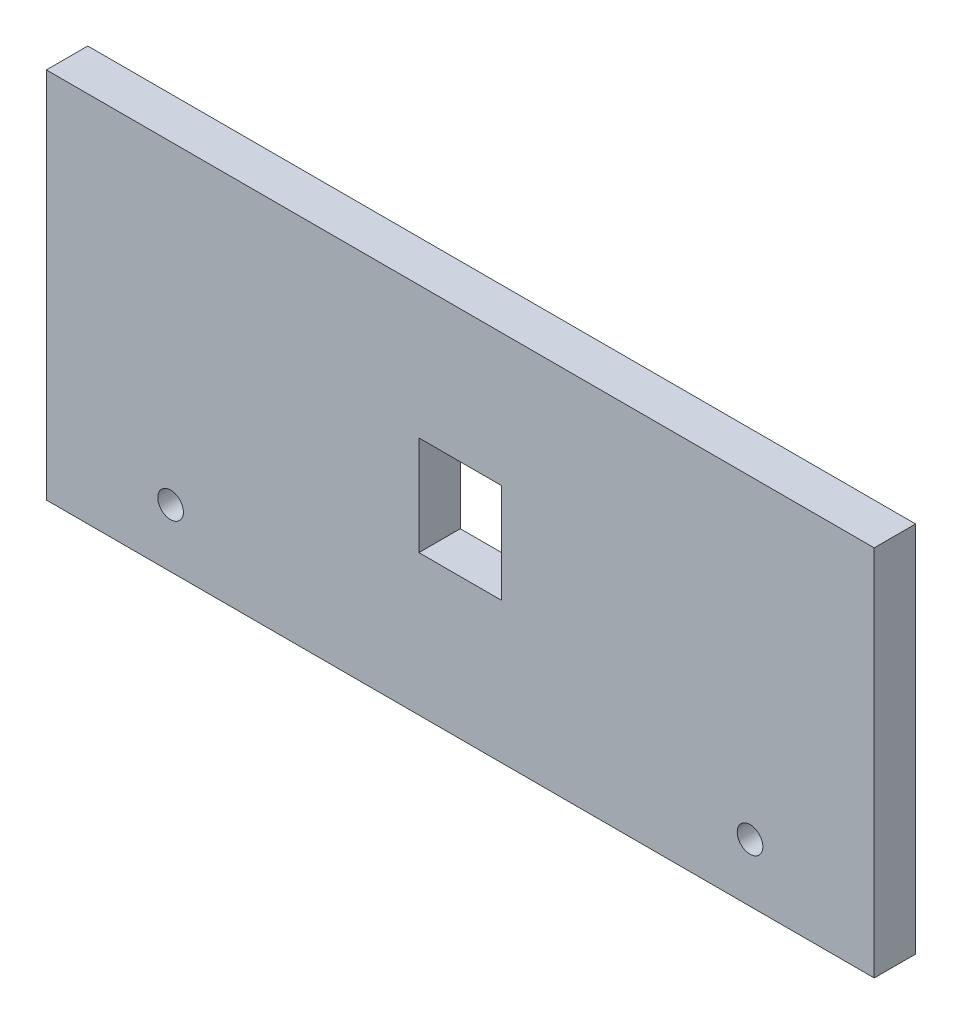
from build123d import *

# Parameters (mm, degrees)
ESQUISSE1_W        = 100
ESQUISSE1_H        = 45
ESQUISSE1_R        = 1.55
ESQUISSE1_W_2      = 10
ESQUISSE1_H_2      = 12
BOSS_EXTRU_1_DEPTH = 5


with BuildPart() as part:
    # Esquisse1 → Boss.-Extru.1 (new body)
    with BuildSketch(Plane.XY):
        Rectangle(ESQUISSE1_W, ESQUISSE1_H)
        with Locations((-35, -15.5)):
            Circle(ESQUISSE1_R, mode=Mode.SUBTRACT)
        with Locations((35, -15.5)):
            Circle(ESQUISSE1_R, mode=Mode.SUBTRACT)
        with Locations((0, 0.5)):
            Rectangle(ESQUISSE1_W_2, ESQUISSE1_H_2, mode=Mode.SUBTRACT)
    extrude(amount=-BOSS_EXTRU_1_DEPTH)


solid = part.part
